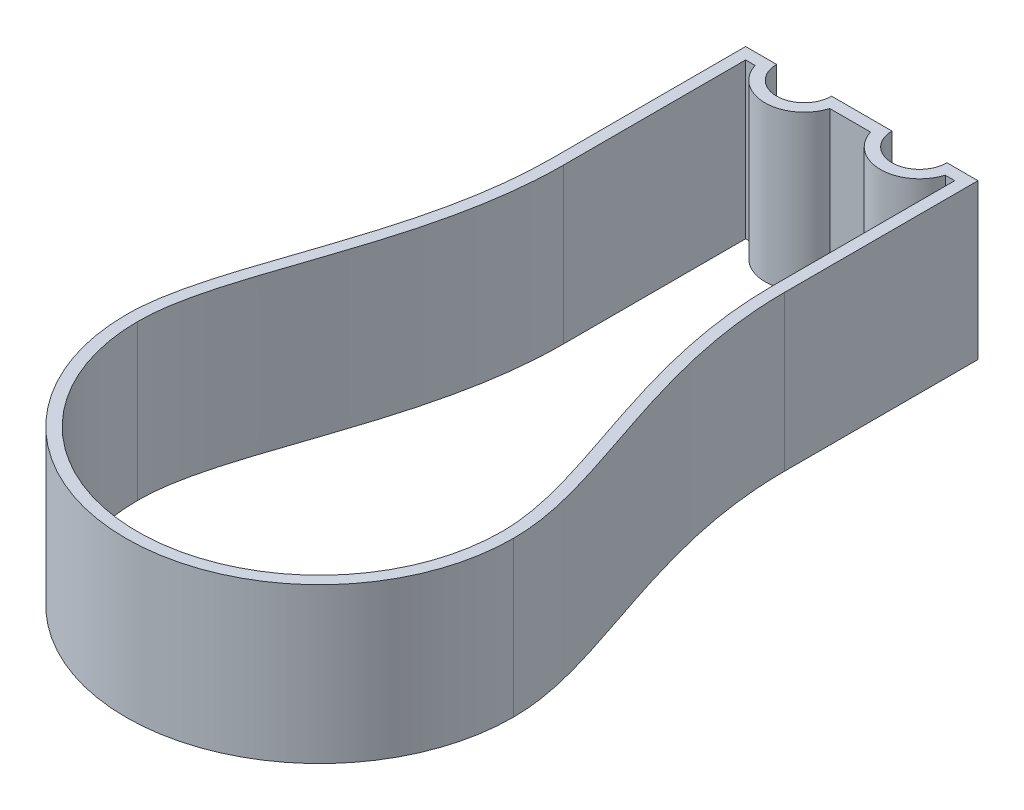
from build123d import *

# Parameters (mm, degrees)
EXTRUDE_1_DEPTH     = 40
CUT_EXTRUDE_1_DEPTH = 211.000364325


with BuildPart() as part:
    # Эскиз1 → Бобышка-Вытянуть1 (new body)
    with BuildSketch(Plane(origin=(0, 0, 0), x_dir=(1, 0, 0), z_dir=(0, 1, 0))):
        with BuildLine():
            Line((0, 0), (8, 0))
            ThreePointArc((8, 0), (15.1, -7.1), (22.2, 0))
            Line((22.2, 0), (37.8, 0))
            ThreePointArc((37.8, 0), (44.9, -7.1), (52, 0))
            Line((52, 0), (60, 0))
            Line((60, 0), (60, -50))
            add(Edge.make_bspline(
                [(60, -50), (60, -86.116353651), (80.160728995, -116.642608399), (80, -140)],
                knots=[0, 0, 0, 0, 1, 1, 1, 1], degree=3))
            ThreePointArc((80, -140), (30, -190), (-20, -140))
            add(Edge.make_bspline(
                [(0, -50), (0, -86.116353651), (-20.160728995, -116.642608399), (-20, -140)],
                knots=[0, 0, 0, 0, 1, 1, 1, 1], degree=3))
            Line((0, -50), (0, 0))
        make_face()
    extrude(amount=EXTRUDE_1_DEPTH)

    # Эскиз2 → Вырез-Вытянуть1 (cut, through all)
    with BuildSketch(Plane.XZ):
        with BuildLine():
            Line((3, 50), (3, 3))
            Line((3, 3), (5.455830777, 3))
            ThreePointArc((5.455830777, 3), (15.1, 10.1), (24.744169223, 3))
            Line((24.744169223, 3), (35.255830777, 3))
            ThreePointArc((35.255830777, 3), (44.9, 10.1), (54.544169223, 3))
            Line((54.544169223, 3), (57, 3))
            Line((57, 3), (57, 50))
            add(Edge.make_bspline(
                [(57, 50), (57, 51.157609129), (57.040606582, 53.481410198), (57.273704219, 58.056259254), (57.830047707, 63.685631551), (58.858223783, 70.278683586), (60.625819875, 78.854483127), (63.422404864, 89.162496802), (67.223313935, 100.856350391), (70.98262402, 111.850711206), (73.680271867, 120.398992166), (75.344252207, 126.83842419), (76.290135947, 131.459638595), (76.783312256, 135.122784785), (76.977813987, 137.947550146), (77.004716082, 139.304329707), (76.999998901, 139.989837839)],
                knots=[0, 0, 0, 0, 0.031254674, 0.062509349, 0.125018697, 0.187528046, 0.250037394, 0.375056092, 0.500074789, 0.625093486, 0.750112183, 0.812621532, 0.87513088, 0.937640229, 0.968894903, 1.000149578, 1.000149578, 1.000149578, 1.000149578], degree=3))
            ThreePointArc((76.999998901, 139.989837839), (30, 187), (-16.999998901, 139.989837839))
            add(Edge.make_bspline(
                [(-16.999998901, 139.989837839), (-17.004716082, 139.304329707), (-16.977813987, 137.947550146), (-16.783312256, 135.122784785), (-16.290135947, 131.459638595), (-15.344252207, 126.83842419), (-13.680271867, 120.398992166), (-10.98262402, 111.850711206), (-7.223313935, 100.856350391), (-3.422404864, 89.162496802), (-0.625819875, 78.854483127), (1.141776217, 70.278683586), (2.169952293, 63.685631551), (2.726295781, 58.056259254), (2.959393418, 53.481410198), (3, 51.157609129), (3, 50)],
                knots=[-0.000149578, -0.000149578, -0.000149578, -0.000149578, 0.031105097, 0.062359771, 0.12486912, 0.187378468, 0.249887817, 0.374906514, 0.499925211, 0.624943908, 0.749962606, 0.812471954, 0.874981303, 0.937490651, 0.968745326, 1, 1, 1, 1], degree=3))
        make_face()
    extrude(amount=-CUT_EXTRUDE_1_DEPTH, mode=Mode.SUBTRACT)


solid = part.part
